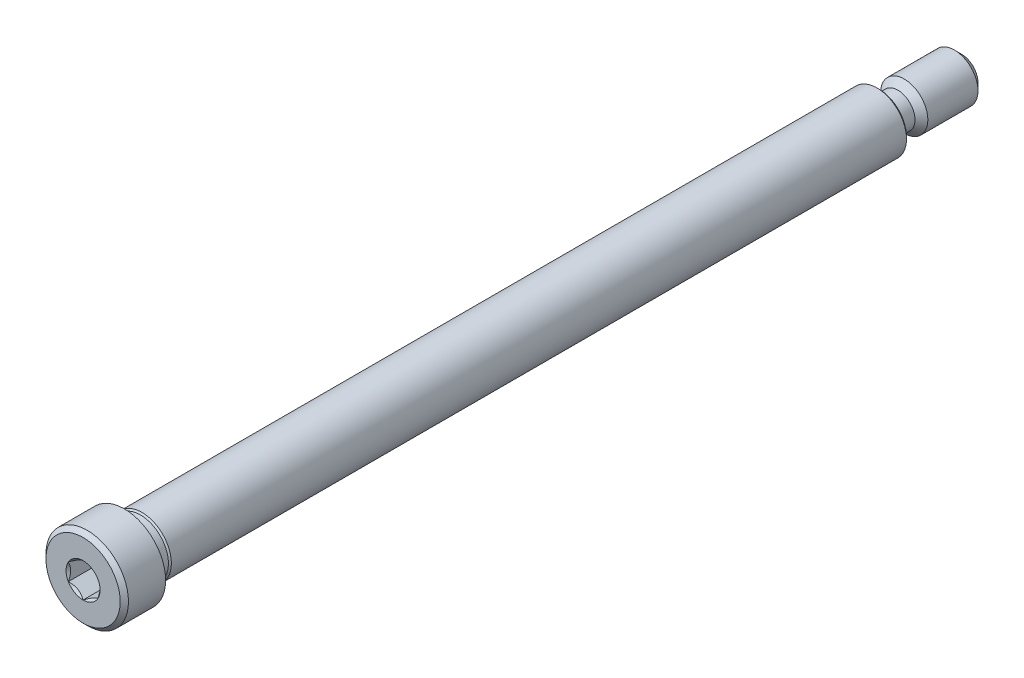
from build123d import *

# Parameters (mm, degrees)
CUT_EXTRUDE1_DEPTH = 4.1671875


with BuildPart() as part:
    # Sketch4 → Revolve1 (revolve)
    with BuildSketch(Plane(origin=(0, 0, 0), x_dir=(0, 0, -1), z_dir=(1, 0, 0))):
        Polygon((-53.578125, 5.55625), (-58.57875, 5.55625), (-59.134375, 5.000625), (-59.134375, 0), (48.021875, 0), (48.021875, 3.704166667), (47.757291667, 3.96875), (-51.215925, 3.96875), (-51.4143625, 3.7703125), (-53.3796875, 3.7703125), (-53.578125, 3.96875), align=None)
    revolve(axis=Axis((0, 0, 59.134375), (0, 0, -1)))

    # Sketch5 → Cut-Extrude1 (cut)
    with BuildSketch(Plane.XY.offset(59.134375)):
        Polygon((1.984375, 1.14567944), (0, 2.291358881), (-1.984375, 1.14567944), (-1.984375, -1.14567944), (0, -2.291358881), (1.984375, -1.14567944), align=None)
    extrude(amount=-CUT_EXTRUDE1_DEPTH, mode=Mode.SUBTRACT)

    # Cut-Extrude4 cone 1 section (through the dimple's axis) → Cut-Extrude4 (revolve, cut)
    with BuildSketch(Plane(origin=(0, 0, 59.134375), x_dir=(0, -1, 0), z_dir=(1, 0, 0))):
        Polygon((0, 0), (2.291358881, 0), (0, 2.291358881), align=None)
    revolve(axis=Axis((0, 0, 59.134375), (0, 0, -1)), mode=Mode.SUBTRACT)

    # Sketch7 → Revolve2 (revolve)
    with BuildSketch(Plane(origin=(0, 0, 0), x_dir=(0, 0, -1), z_dir=(1, 0, 0))):
        Polygon((48.021875, 3.175), (58.181875, 3.175), (59.134375, 2.2225), (59.134375, 0), (48.021875, 0), align=None)
    revolve(axis=Axis((0, 0, -59.134375), (0, 0, 1)))

    # Sketch10 → Cut-Revolve1 (revolve, cut)
    with BuildSketch(Plane(origin=(0, 0, 0), x_dir=(0, 0, -1), z_dir=(1, 0, 0))):
        with BuildLine():
            Line((48.885475, 2.3114), (50.561875, 2.3114))
            Line((50.561875, 2.3114), (52.219225, 3.96875))
            Line((52.219225, 3.96875), (48.021875, 3.96875))
            Line((48.021875, 3.96875), (48.021875, 3.175))
            ThreePointArc((48.021875, 3.175), (48.274817584, 2.564342584), (48.885475, 2.3114))
        make_face()
    revolve(axis=Axis((0, 0, -59.134375), (0, 0, 1)), mode=Mode.SUBTRACT)


solid = part.part
